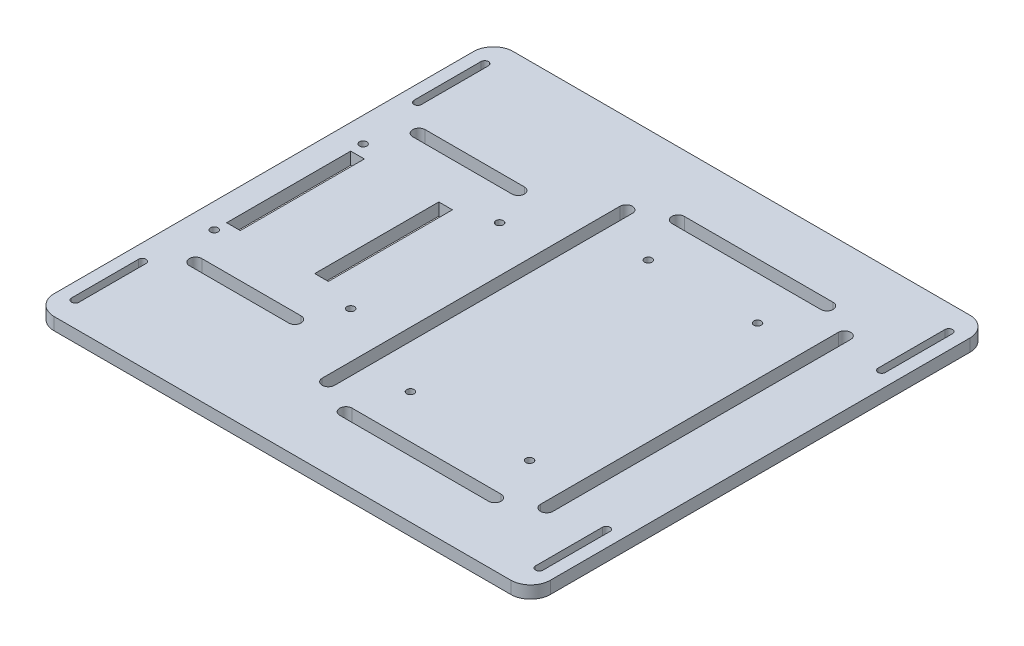
from build123d import *

# Parameters (mm, degrees)
SKETCH2_W           = 200
SKETCH2_H           = 185
BOSS_EXTRUDE1_DEPTH = 5
SKETCH3_W           = 5.5
SKETCH3_H           = 50
SKETCH3_R           = 1.5
CUT_EXTRUDE1_DEPTH  = 137.313058802
SKETCH4_R           = 1.5
CUT_EXTRUDE3_DEPTH  = 137.313058802
FILLET1_R           = 8


with BuildPart() as part:
    # Sketch2 → Boss-Extrude1 (new body)
    with BuildSketch(Plane(origin=(0, 0, 0), x_dir=(1, 0, 0), z_dir=(0, 1, 0))):
        Rectangle(SKETCH2_W, SKETCH2_H)
        with BuildLine():
            Line((-95, 55.5), (-95, 82.5))
            ThreePointArc((-95, 82.5), (-93.5, 84), (-92, 82.5))
            Line((-92, 82.5), (-92, 55.5))
            ThreePointArc((-92, 55.5), (-93.5, 54), (-95, 55.5))
        make_face(mode=Mode.SUBTRACT)
        with BuildLine():
            Line((95, 55.5), (95, 82.5))
            ThreePointArc((95, 82.5), (93.5, 84), (92, 82.5))
            Line((92, 82.5), (92, 55.5))
            ThreePointArc((92, 55.5), (93.5, 54), (95, 55.5))
        make_face(mode=Mode.SUBTRACT)
        with BuildLine():
            Line((95, -55.5), (95, -82.5))
            ThreePointArc((95, -82.5), (93.5, -84), (92, -82.5))
            Line((92, -82.5), (92, -55.5))
            ThreePointArc((92, -55.5), (93.5, -54), (95, -55.5))
        make_face(mode=Mode.SUBTRACT)
        with BuildLine():
            Line((-95, -55.5), (-95, -82.5))
            ThreePointArc((-95, -82.5), (-93.5, -84), (-92, -82.5))
            Line((-92, -82.5), (-92, -55.5))
            ThreePointArc((-92, -55.5), (-93.5, -54), (-95, -55.5))
        make_face(mode=Mode.SUBTRACT)
    extrude(amount=BOSS_EXTRUDE1_DEPTH)

    # Sketch3 → Cut-Extrude1 (cut, through all)
    with BuildSketch(Plane(origin=(0, 5, 0), x_dir=(1, 0, 0), z_dir=(0, 1, 0))):
        with BuildLine():
            Line((-42.5, 47.5), (-82.5, 47.5))
            ThreePointArc((-82.5, 47.5), (-85, 45), (-82.5, 42.5))
            Line((-82.5, 42.5), (-42.5, 42.5))
            ThreePointArc((-42.5, 42.5), (-40, 45), (-42.5, 47.5))
        make_face()
        with BuildLine():
            ThreePointArc((-82.5, -42.5), (-85, -45), (-82.5, -47.5))
            Line((-82.5, -47.5), (-42.5, -47.5))
            ThreePointArc((-42.5, -47.5), (-40, -45), (-42.5, -42.5))
            Line((-42.5, -42.5), (-82.5, -42.5))
        make_face()
        with Locations((-87.25, 0)):
            Rectangle(SKETCH3_W, SKETCH3_H)
        with Locations((-51.75, 0)):
            Rectangle(SKETCH3_W, SKETCH3_H)
        with Locations((-90, -30)):
            Circle(SKETCH3_R)
        with Locations((-90, 30)):
            Circle(SKETCH3_R)
        with Locations((-35, 30)):
            Circle(SKETCH3_R)
        with Locations((-35, -30)):
            Circle(SKETCH3_R)
    extrude(amount=-CUT_EXTRUDE1_DEPTH, mode=Mode.SUBTRACT)

    # Sketch4 → Cut-Extrude3 (cut, through all)
    with BuildSketch(Plane(origin=(0, 5, 0), x_dir=(1, 0, 0), z_dir=(0, 1, 0))):
        with Locations((8, 46.935)):
            Circle(SKETCH4_R)
        with Locations((52, 46.935)):
            Circle(SKETCH4_R)
        with Locations((6, -46.935)):
            Circle(SKETCH4_R)
        with Locations((54, -46.935)):
            Circle(SKETCH4_R)
        with BuildLine():
            Line((71.5, -60), (71.5, 60))
            ThreePointArc((71.5, 60), (74, 62.5), (76.5, 60))
            Line((76.5, 60), (76.5, -60))
            ThreePointArc((76.5, -60), (74, -62.5), (71.5, -60))
        make_face()
        with BuildLine():
            Line((-16.5, -60), (-16.5, 60))
            ThreePointArc((-16.5, 60), (-14, 62.5), (-11.5, 60))
            Line((-11.5, 60), (-11.5, -60))
            ThreePointArc((-11.5, -60), (-14, -62.5), (-16.5, -60))
        make_face()
        with BuildLine():
            Line((0, 69.435), (60, 69.435))
            ThreePointArc((60, 69.435), (62.5, 66.935), (60, 64.435))
            Line((60, 64.435), (0, 64.435))
            ThreePointArc((0, 64.435), (-2.5, 66.935), (0, 69.435))
        make_face()
        with BuildLine():
            Line((0, -69.435), (60, -69.435))
            ThreePointArc((60, -69.435), (62.5, -66.935), (60, -64.435))
            Line((60, -64.435), (0, -64.435))
            ThreePointArc((0, -64.435), (-2.5, -66.935), (0, -69.435))
        make_face()
    extrude(amount=-CUT_EXTRUDE3_DEPTH, mode=Mode.SUBTRACT)

    # Fillet1
    fillet1_edges = [part.edges().sort_by_distance(p)[0] for p in [
        (100, 2.5, -92.5),
        (100, 2.5, 92.5),
        (-100, 2.5, -92.5),
        (-100, 2.5, 92.5),
    ]]
    fillet(fillet1_edges, radius=FILLET1_R)


solid = part.part
